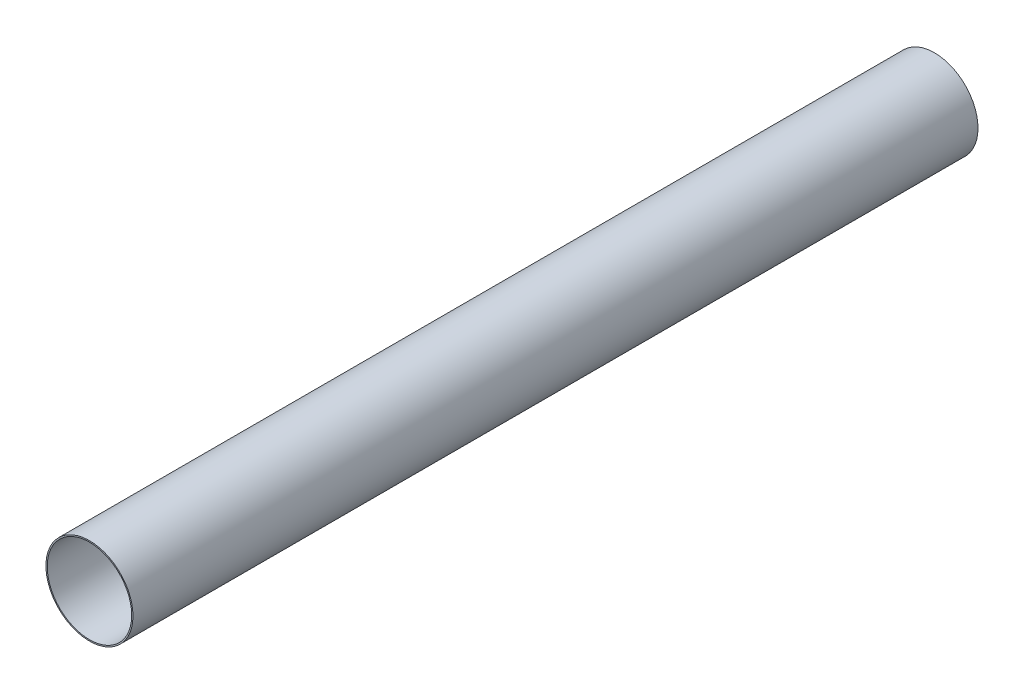
from build123d import *

# Parameters (mm, degrees)
SKETCH1_R           = 39.2557
SKETCH1_R_2         = 38.1
BOSS_EXTRUDE1_DEPTH = 381


with BuildPart() as part:
    # Sketch1 → Boss-Extrude1 (new, symmetric)
    with BuildSketch(Plane.XY):
        Circle(SKETCH1_R)
        Circle(SKETCH1_R_2, mode=Mode.SUBTRACT)
    extrude(amount=BOSS_EXTRUDE1_DEPTH, both=True)


solid = part.part
